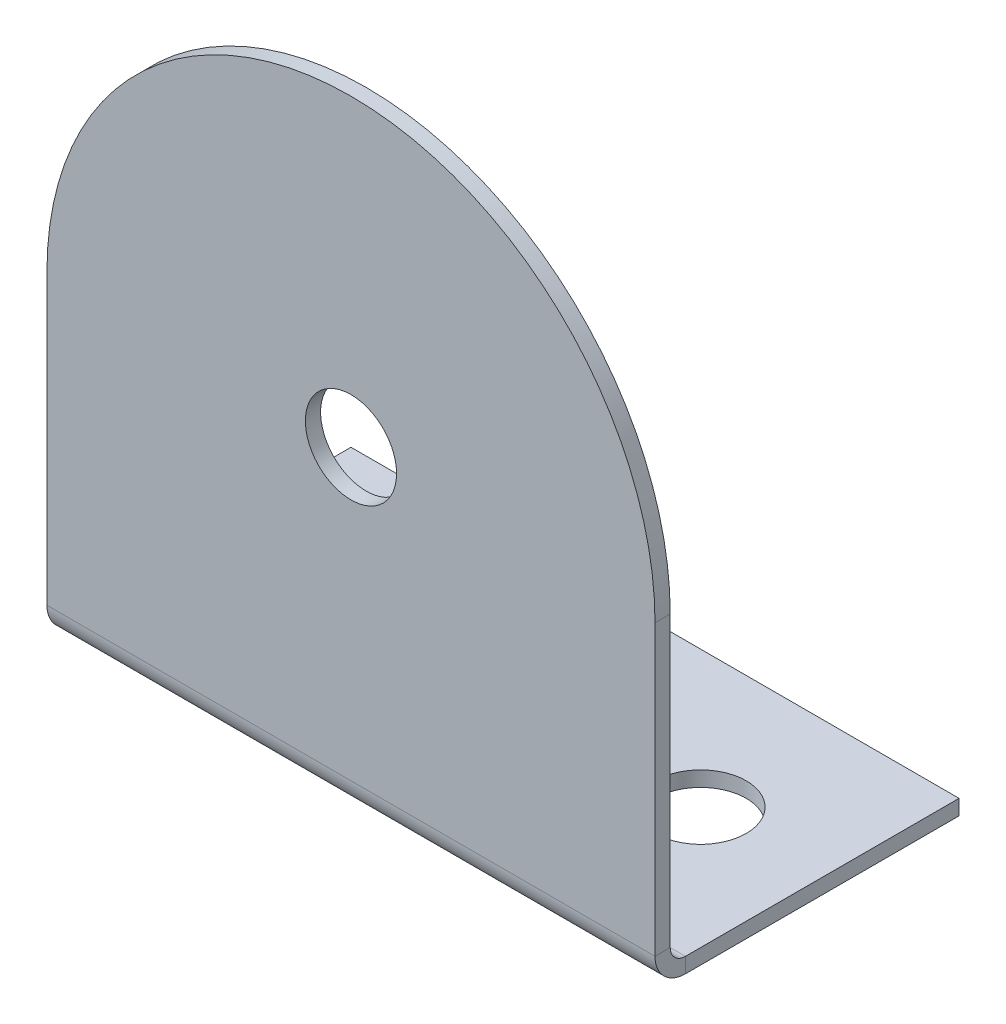
from build123d import *

# Parameters (mm, degrees)
BRIDA_BASE1_DEPTH     = 20
CROQUIS5_R            = 1.5
CORTAR_EXTRUIR1_DEPTH = 10
CROQUIS6_R            = 1.5
CORTAR_EXTRUIR2_DEPTH = 10


# Sheet-metal steps are written as plain solids
with BuildPart() as part:
    # Croquis1 → Brida base1 (new body)
    with BuildSketch(Plane(origin=(0, 0, 0), x_dir=(0, 0, -1), z_dir=(1, 0, 0))):
        with BuildLine():
            Line((0, 20.5), (0, 1))
            ThreePointArc((0, 1), (0.292893219, 0.292893219), (1, 0))
            Line((1, 0), (10, 0))
            Line((10, 0), (10, 0.5))
            Line((10, 0.5), (1, 0.5))
            ThreePointArc((1, 0.5), (0.646446609, 0.646446609), (0.5, 1))
            Line((0.5, 1), (0.5, 20.5))
            Line((0.5, 20.5), (0, 20.5))
        make_face()
    extrude(amount=BRIDA_BASE1_DEPTH)

    # Croquis5 → Cortar-Extruir1 (cut)
    with BuildSketch(Plane(origin=(0, 0.5, 0), x_dir=(1, 0, 0), z_dir=(0, 1, 0))):
        with Locations(Location((4, 5.5, 0), (0, 0, 270))):
            Circle(CROQUIS5_R)
        with Locations(Location((16, 5.5, 0), (0, 0, 270))):
            Circle(CROQUIS5_R)
    extrude(amount=-CORTAR_EXTRUIR1_DEPTH, mode=Mode.SUBTRACT)

    # Croquis6 → Cortar-Extruir2 (cut)
    with BuildSketch(Plane.XY):
        with BuildLine():
            ThreePointArc((0, 10.5), (2.928932188, 17.571067812), (10, 20.5))
            Line((10, 20.5), (0, 20.5))
            Line((0, 20.5), (0, 10.5))
        make_face()
        with BuildLine():
            ThreePointArc((10, 20.5), (17.071067812, 17.571067812), (20, 10.5))
            Line((20, 10.5), (20, 20.5))
            Line((20, 20.5), (10, 20.5))
        make_face()
        with Locations(Location((10, 10.5, 0), (0, 0, 90))):
            Circle(CROQUIS6_R)
    extrude(amount=-CORTAR_EXTRUIR2_DEPTH, mode=Mode.SUBTRACT)


solid = part.part
